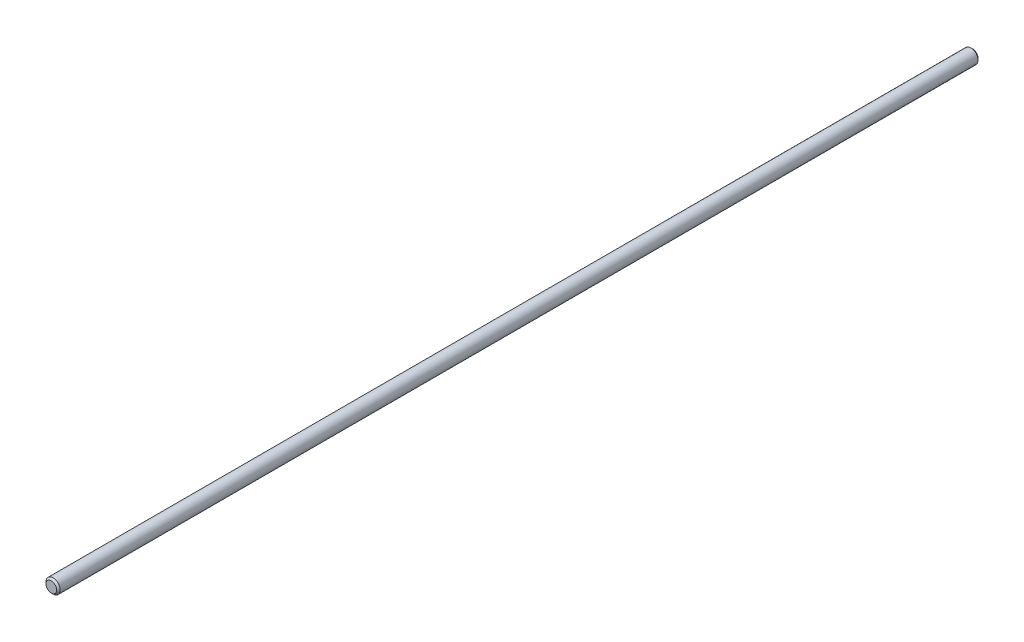
from build123d import *

# Parameters (mm, degrees)
SKETCH_1_R      = 2
EXTRUDE_1_DEPTH = 260
CHAMFER_1_SIZE  = 0.5


with BuildPart() as part:
    # 草图1 → 凸台-拉伸1 (new body)
    with BuildSketch(Plane.XY):
        Circle(SKETCH_1_R)
    extrude(amount=-EXTRUDE_1_DEPTH)

    # 倒角1
    chamfer_1_edges = [part.edges().sort_by_distance(p)[0] for p in [
        (-2, 0, -260),
        (-2, 0, 0),
    ]]
    chamfer(chamfer_1_edges, length=CHAMFER_1_SIZE)


solid = part.part
